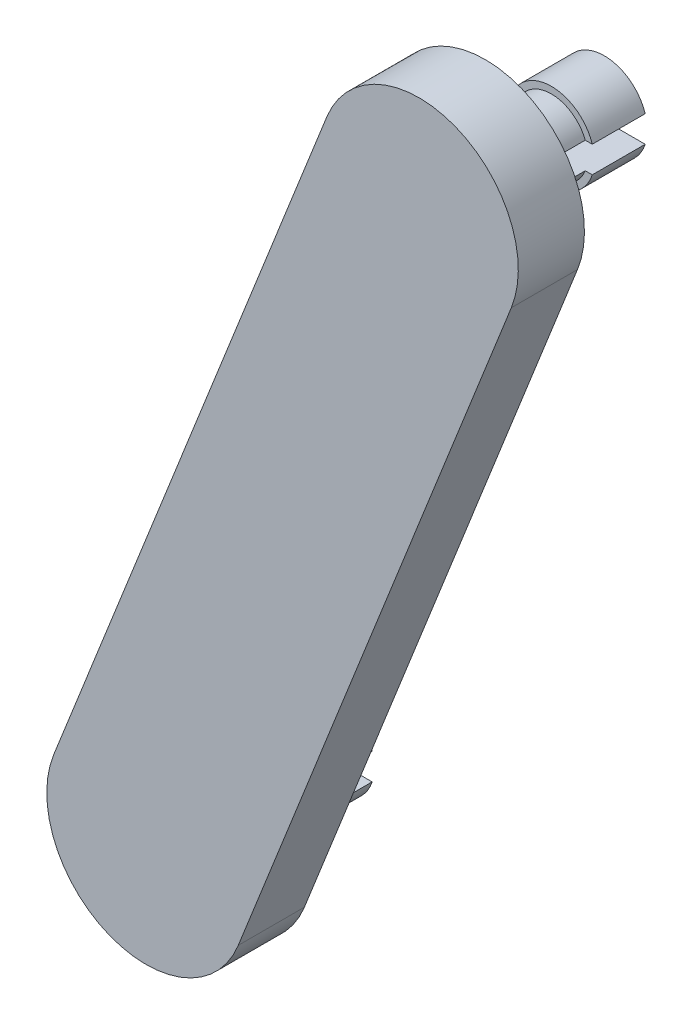
from build123d import *

# Parameters (mm, degrees)
BOSS_EXTRU_1_DEPTH      = 5
ESQUISSE3_R             = 2.75
BOSS_EXTRU_2_DEPTH      = 5
ESQUISSE4_R             = 3.25
BOSS_EXTRU_3_DEPTH      = 4
ESQUISSE5_W             = 10
ESQUISSE5_H             = 2
ENL_V_MAT_EXTRU_1_DEPTH = 9


with BuildPart() as part:
    # Esquisse1 → Boss.-Extru.1 (new body)
    with BuildSketch(Plane.XY):
        with BuildLine():
            Line((-145.281319594, -37.307724084), (-124.641872734, 14.750063357))
            ThreePointArc((-124.641872734, 14.750063357), (-114.905635997, 18.957876828), (-110.697822526, 9.221640091))
            Line((-110.697822526, 9.221640091), (-131.337269387, -42.83614735))
            ThreePointArc((-131.337269387, -42.83614735), (-141.073506124, -47.043960821), (-145.281319594, -37.307724084))
        make_face()
    extrude(amount=BOSS_EXTRU_1_DEPTH)

    # Esquisse3 → Boss.-Extru.2 (add)
    with BuildSketch(Plane.XY):
        with Locations((-117.66984763, 11.985851724)):
            Circle(ESQUISSE3_R)
        with Locations((-138.309294491, -40.071935717)):
            Circle(ESQUISSE3_R)
    extrude(amount=-BOSS_EXTRU_2_DEPTH)

    # Esquisse4 → Boss.-Extru.3 (add)
    with BuildSketch(Plane(origin=(0, 0, -5), x_dir=(-1, 0, 0), z_dir=(0, 0, -1))):
        with Locations((117.66984763, 11.985851724)):
            Circle(ESQUISSE4_R)
        with Locations((138.309294491, -40.071935717)):
            Circle(ESQUISSE4_R)
    extrude(amount=BOSS_EXTRU_3_DEPTH)

    # Esquisse5 → Enlèv. mat.-Extru.1 (cut)
    with BuildSketch(Plane(origin=(0, 0, -9), x_dir=(-1, 0, 0), z_dir=(0, 0, -1))):
        with Locations((138.309294491, -40.071935717)):
            Rectangle(ESQUISSE5_W, ESQUISSE5_H)
        with Locations((117.66984763, 11.985851724)):
            Rectangle(ESQUISSE5_W, ESQUISSE5_H)
    extrude(amount=-ENL_V_MAT_EXTRU_1_DEPTH, mode=Mode.SUBTRACT)


solid = part.part
